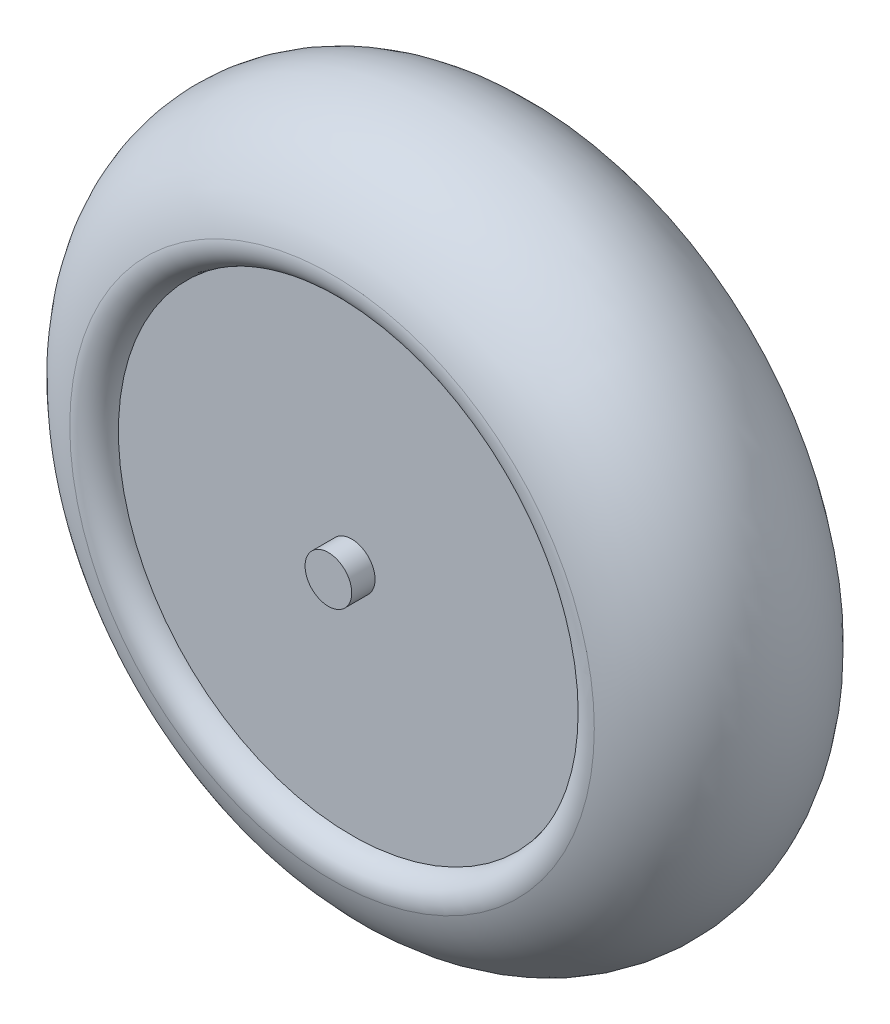
from build123d import *

# Parameters (mm, degrees)
BOSS_EXTRUDE1_DEPTH      = 10.16
BOSS_EXTRUDE1_DEPTH_BACK = 10.16
SKETCH4_R                = 25.4
SKETCH5_R                = 2.54
BOSS_EXTRUDE2_DEPTH      = 2.54
FILLET1_R                = 2.54


with BuildPart() as part:
    # Sketch1 → Revolve1 (revolve)
    with BuildSketch(Plane(origin=(0, 0, 0), x_dir=(0, 0, -1), z_dir=(1, 0, 0)), mode=Mode.PRIVATE) as revolve1_sk:
        with BuildLine():
            Line((-12.7, 25.4), (12.7, 25.4))
            ThreePointArc((12.7, 25.4), (0, 38.1), (-12.7, 25.4))
        make_face()
    revolve(revolve1_sk.sketch.rotate(Axis((0, 0, 0), (0, 0, -1)), 90), axis=Axis((0, 0, 0), (0, 0, -1)))

    # Sketch4 → Boss-Extrude1 (add, two sides: drawn at the far end of the back side and taken through both)
    with BuildSketch(Plane.XY.offset(-BOSS_EXTRUDE1_DEPTH_BACK)):
        Circle(SKETCH4_R)
    extrude(amount=BOSS_EXTRUDE1_DEPTH + BOSS_EXTRUDE1_DEPTH_BACK)

    # Sketch5 → Boss-Extrude2 (add)
    with BuildSketch(Plane.XY.offset(10.16)):
        Circle(SKETCH5_R)
    boss_extrude2 = extrude(amount=BOSS_EXTRUDE2_DEPTH)

    # Mirror1: Boss-Extrude2 across plane
    add(boss_extrude2.mirror(Plane.XY))

    # Fillet1
    # the kernel refuses this fillet: 2.54 mm, written as the material it takes off along each edge
    with BuildSketch(Plane(origin=(0, 0, -12.7), x_dir=(1, 0, 0), z_dir=(0, 1, 0))) as fillet1_piece_1:
        with BuildLine():
            CenterArc((27.920078124, -2.8575), FILLET1_R, 75.638488437, 97.180755781)
            Line((25.4, -2.54), (25.349598438, -2.53365))
            ThreePointArc((25.349598438, -2.53365), (25.3492, -1.27), (25.3492, 0))
            Line((25.3492, 0), (25.4, 0.0508))
            ThreePointArc((25.4, 0.0508), (26.99385, -0.049207819), (28.562698045, -0.3476625))
            Line((28.562698045, -0.3476625), (28.550097655, -0.396875))
        make_face()
    revolve(axis=Axis((0, 0, -12.7), (0, 0, -1)), mode=Mode.SUBTRACT)
    with BuildSketch(Plane(origin=(0, 0, 12.7), x_dir=(1, 0, 0), z_dir=(0, 1, 0))) as fillet1_piece_2:
        with BuildLine():
            CenterArc((27.920078124, 2.8575), FILLET1_R, 187.180755781, 97.180755781)
            Line((28.550097655, 0.396875), (28.562698045, 0.3476625))
            ThreePointArc((28.562698045, 0.3476625), (26.99385, 0.049207819), (25.4, -0.0508))
            Line((25.4, -0.0508), (25.3492, 0))
            ThreePointArc((25.3492, 0), (25.3492, 1.27), (25.349598438, 2.53365))
            Line((25.349598438, 2.53365), (25.4, 2.54))
        make_face()
    revolve(axis=Axis((0, 0, 12.7), (0, 0, -1)), mode=Mode.SUBTRACT)


solid = part.part
